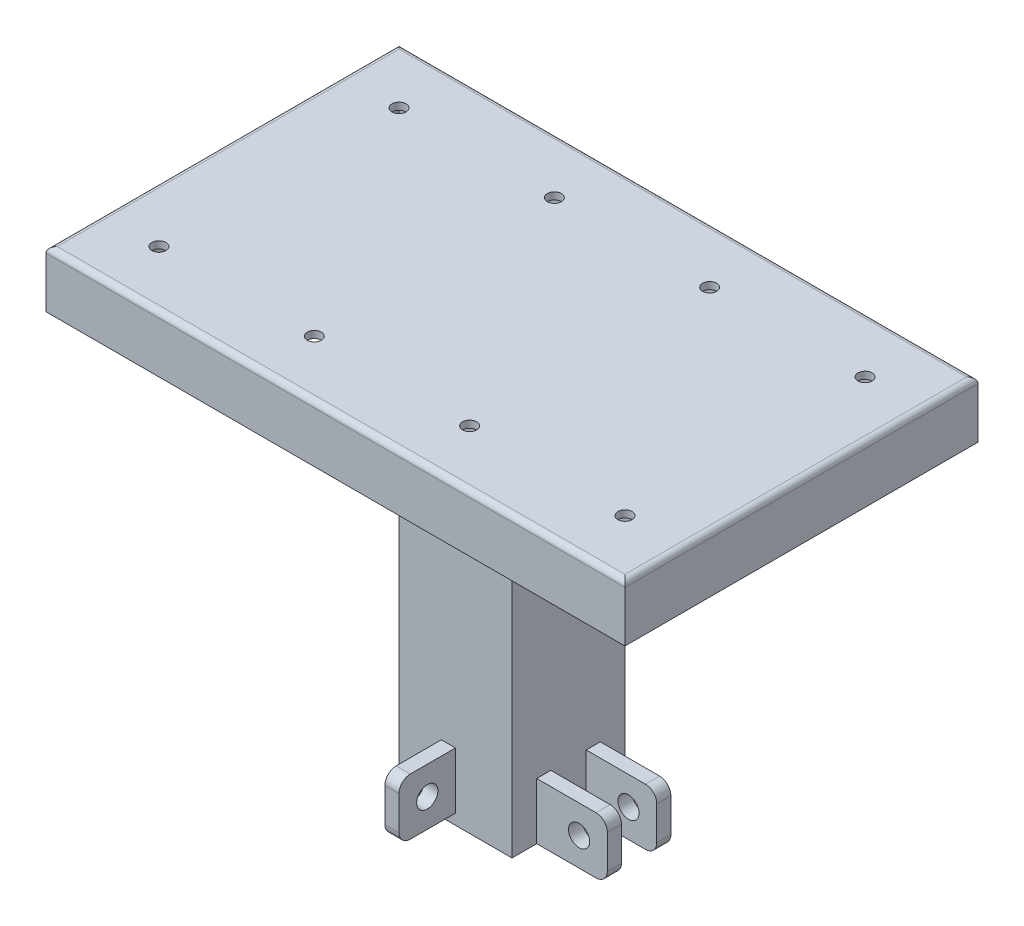
from build123d import *

# Parameters (mm, degrees)
SKETCH1_W                   = 260.35
SKETCH1_H                   = 158.75
BOSS_EXTRUDE1_DEPTH         = 25.4
SHELL1_T                    = -3.175
SKETCH2_W                   = 50.8
SKETCH2_H                   = 50.8
BOSS_EXTRUDE2_DEPTH         = 184.15
SHELL2_START                = -161.925
SHELL2_OUTLINE_W            = 44.45
SHELL2_OUTLINE_H            = 44.45
SHELL2_DEPTH                = 184.15
BOSS_EXTRUDE3_DEPTH         = 3.175
FILLET1_R                   = 2.54
SKETCH6_W                   = 31.75
SKETCH6_H                   = 25.4
SKETCH6_R                   = 4.7625
BOSS_EXTRUDE4_DEPTH         = 6.35
FILLET2_R                   = 5.08
SKETCH7_W                   = 25.4
SKETCH7_H                   = 25.4
SKETCH7_R                   = 4.7625
BOSS_EXTRUDE5_DEPTH         = 6.35
FILLET3_R                   = 5.08
FILLET3_OF_MIRROR3_R        = 5.08
F_1_4_0_25_DIAMETER_HOLE1_D = 6.35


# Read off the part's stored shape, not the designer's step: Shell2
with BuildPart() as part:
    # Sketch1 → Boss-Extrude1 (new body)
    with BuildSketch(Plane(origin=(0, 0, 0), x_dir=(1, 0, 0), z_dir=(0, 1, 0))):
        Rectangle(SKETCH1_W, SKETCH1_H)
    extrude(amount=BOSS_EXTRUDE1_DEPTH)

    # Shell1
    shell1_openings = [part.faces().sort_by_distance(p)[0] for p in [
        (0, 0, 0),
    ]]
    offset(amount=SHELL1_T, openings=shell1_openings, kind=Kind.INTERSECTION)

    # Sketch2 → Boss-Extrude2 (add)
    with BuildSketch(Plane.XZ.offset(-22.225)):
        Rectangle(SKETCH2_W, SKETCH2_H)
    extrude(amount=BOSS_EXTRUDE2_DEPTH)

    # Shell2 outline → Shell2 (cut)
    with BuildSketch(Plane(origin=(0, 0, 0), x_dir=(1, 0, 0), z_dir=(0, 1, 0)).offset(SHELL2_START)):
        Rectangle(SHELL2_OUTLINE_W, SHELL2_OUTLINE_H)
    extrude(amount=SHELL2_DEPTH, mode=Mode.SUBTRACT)

    # Sketch4 → Boss-Extrude3 (add, symmetric)
    with BuildSketch(Plane.XY):
        Polygon((25.4, -9.525), (63.5, 22.225), (123.01410253, 22.225), (25.4, -59.120085442), align=None)
    boss_extrude3 = extrude(amount=BOSS_EXTRUDE3_DEPTH, both=True)

    # Mirror1: Boss-Extrude3 across plane
    add(boss_extrude3.mirror(Plane(origin=(0, 0, 0), x_dir=(0, 0, 1), z_dir=(1, 0, 0))))

    # Fillet1
    fillet1_edges = [part.edges().sort_by_distance(p)[0] for p in [
        (-130.175, 25.4, 0),
        (0, 25.4, 79.375),
        (130.175, 25.4, 0),
        (0, 25.4, -79.375),
    ]]
    fillet(fillet1_edges, radius=FILLET1_R)

    # Sketch6 → Boss-Extrude4 (add)
    with BuildSketch(Plane.XY.offset(14.2875)):
        with Locations((41.275, -149.225)):
            Rectangle(SKETCH6_W, SKETCH6_H)
        with Locations((44.45, -149.225)):
            Circle(SKETCH6_R, mode=Mode.SUBTRACT)
    boss_extrude4 = extrude(amount=-BOSS_EXTRUDE4_DEPTH)

    # Mirror2: Boss-Extrude4 across plane
    add(boss_extrude4.mirror(Plane.XY))

    # Fillet2
    fillet2_edges = [part.edges().sort_by_distance(p)[0] for p in [
        (57.15, -161.925, -11.1125),
        (57.15, -136.525, -11.1125),
        (57.15, -136.525, 11.1125),
        (57.15, -161.925, 11.1125),
    ]]
    fillet(fillet2_edges, radius=FILLET2_R)

    # Sketch7 → Boss-Extrude5 (add)
    with BuildSketch(Plane(origin=(0, 0, 0), x_dir=(0, 0, -1), z_dir=(1, 0, 0))):
        with Locations((-38.1, -144.4625)):
            Rectangle(SKETCH7_W, SKETCH7_H)
        with Locations((-38.1, -144.4625)):
            Circle(SKETCH7_R, mode=Mode.SUBTRACT)
    boss_extrude5 = extrude(amount=-BOSS_EXTRUDE5_DEPTH)

    # Fillet3
    fillet3_edges = [part.edges().sort_by_distance(p)[0] for p in [
        (-3.175, -157.1625, 50.8),
        (-3.175, -131.7625, 50.8),
    ]]
    fillet(fillet3_edges, radius=FILLET3_R)

    # Mirror3: Boss-Extrude5 across plane
    add(boss_extrude5.mirror(Plane.XY))

    # Fillet3 of Mirror3
    fillet3_of_mirror3_edges = [part.edges().sort_by_distance(p)[0] for p in [
        (-3.175, -157.1625, -50.8),
        (-3.175, -131.7625, -50.8),
    ]]
    fillet(fillet3_of_mirror3_edges, radius=FILLET3_OF_MIRROR3_R)

    # 1/4 (0.25) Diameter Hole1 (through all)
    with Locations(Plane(origin=(0, 25.4, 0), x_dir=(1, 0, 0), z_dir=(0, 1, 0))):
        with Locations((-104.775, 53.975), (-34.925, 53.975), (34.925, 53.975), (104.775, 53.975)):
            f_1_4_0_25_diameter_hole1 = Hole(F_1_4_0_25_DIAMETER_HOLE1_D / 2)

    # Mirror4: 1/4 (0.25) Diameter Hole1 across plane
    add(f_1_4_0_25_diameter_hole1.mirror(Plane.XY), mode=Mode.SUBTRACT)


solid = part.part
